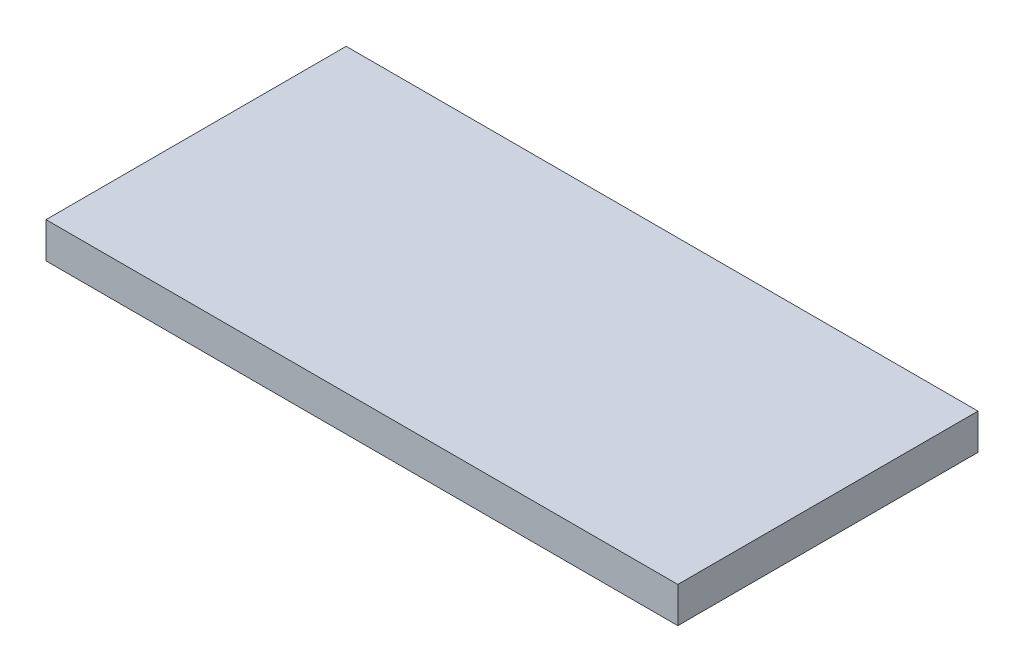
from build123d import *

# Parameters (mm, degrees)
SKETCH2_W           = 221
SKETCH2_H           = 105
BOSS_EXTRUDE1_DEPTH = 2.5
SKETCH3_W           = 221
SKETCH3_H           = 105
SKETCH3_W_2         = 216
SKETCH3_H_2         = 100
BOSS_EXTRUDE2_DEPTH = 10


with BuildPart() as part:
    # Sketch2 → Boss-Extrude1 (new body)
    with BuildSketch(Plane(origin=(0, 0, 0), x_dir=(1, 0, 0), z_dir=(0, 1, 0))):
        Rectangle(SKETCH2_W, SKETCH2_H)
    extrude(amount=BOSS_EXTRUDE1_DEPTH)

    # Sketch3 → Boss-Extrude2 (add)
    with BuildSketch(Plane.XZ):
        Rectangle(SKETCH3_W, SKETCH3_H)
        Rectangle(SKETCH3_W_2, SKETCH3_H_2, mode=Mode.SUBTRACT)
    extrude(amount=BOSS_EXTRUDE2_DEPTH)


solid = part.part
